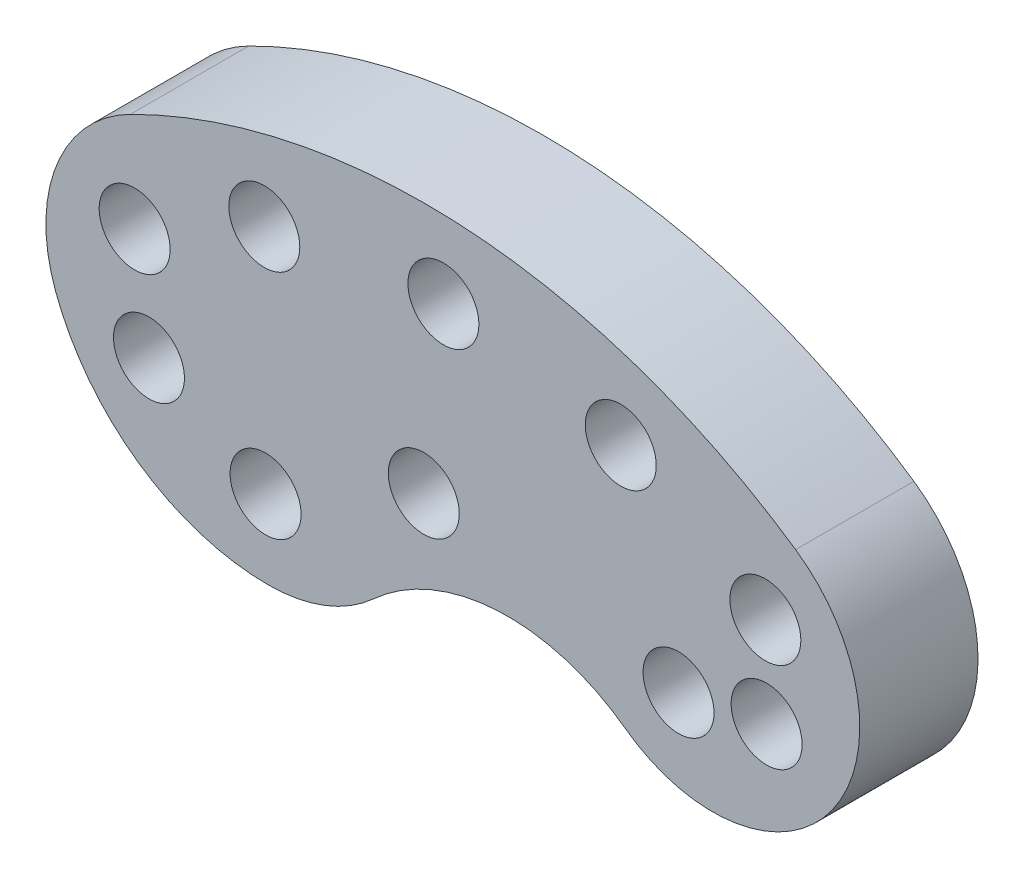
from build123d import *

# Parameters (mm, degrees)
BOSS_EXTRUDE1_DEPTH   = 10
SKETCH2_R             = 3
CUT_EXTRUDE1_DEPTH    = 10
CRVPATTERN1_OUTLINE_R = 3
CRVPATTERN1_DEPTH     = 10


# Read off the part's stored shape, not the designer's step: CrvPattern1
with BuildPart() as part:
    # Sketch1 → Boss-Extrude1 (new body)
    with BuildSketch(Plane.XY):
        with BuildLine():
            ThreePointArc((-12.160643086, -4.500395473), (-12.066298067, 4.747552068), (-5.833593115, 11.580327761))
            ThreePointArc((-5.833593115, 11.580327761), (22.801277697, 17.386949302), (50.413138808, 7.834054132))
            ThreePointArc((50.413138808, 7.834054132), (53.544482095, -9.628731125), (36.032050188, -12.46931353))
            ThreePointArc((36.032050188, -12.46931353), (25.188301018, -9.23349986), (14.747114027, -13.59687016))
            ThreePointArc((14.747114027, -13.59687016), (10.621121624, -16.149691652), (5.851758877, -17.040696634))
            ThreePointArc((5.851758877, -17.040696634), (-5.122139447, -13.59687016), (-12.160643086, -4.500395473))
        make_face()
    extrude(amount=BOSS_EXTRUDE1_DEPTH)

    # Sketch2 → Cut-Extrude1 (cut)
    with BuildSketch(Plane.XY.offset(10)):
        with Locations((5.495652988, 9.028732309)):
            Circle(SKETCH2_R)
    extrude(amount=-CUT_EXTRUDE1_DEPTH, mode=Mode.SUBTRACT)

    # CrvPattern1 outline → CrvPattern1 (cut)
    with BuildSketch(Plane.XY):
        with Locations((-5.463573367, 3.372342928)):
            Circle(CRVPATTERN1_OUTLINE_R)
        with Locations((-4.253847863, -5.460432999)):
            Circle(CRVPATTERN1_OUTLINE_R)
        with Locations((5.602614411, -10.492104281)):
            Circle(CRVPATTERN1_OUTLINE_R)
        with Locations((18.978303952, -3.768285721)):
            Circle(CRVPATTERN1_OUTLINE_R)
        with Locations((40.513825045, -7.583139488)):
            Circle(CRVPATTERN1_OUTLINE_R)
        with Locations((47.960307029, -6.163614465)):
            Circle(CRVPATTERN1_OUTLINE_R)
        with Locations((47.853730427, 1.416213148)):
            Circle(CRVPATTERN1_OUTLINE_R)
        with Locations((35.630316045, 8.091012477)):
            Circle(CRVPATTERN1_OUTLINE_R)
        with Locations((20.637040529, 10.939744191)):
            Circle(CRVPATTERN1_OUTLINE_R)
    extrude(amount=CRVPATTERN1_DEPTH, mode=Mode.SUBTRACT)


solid = part.part
